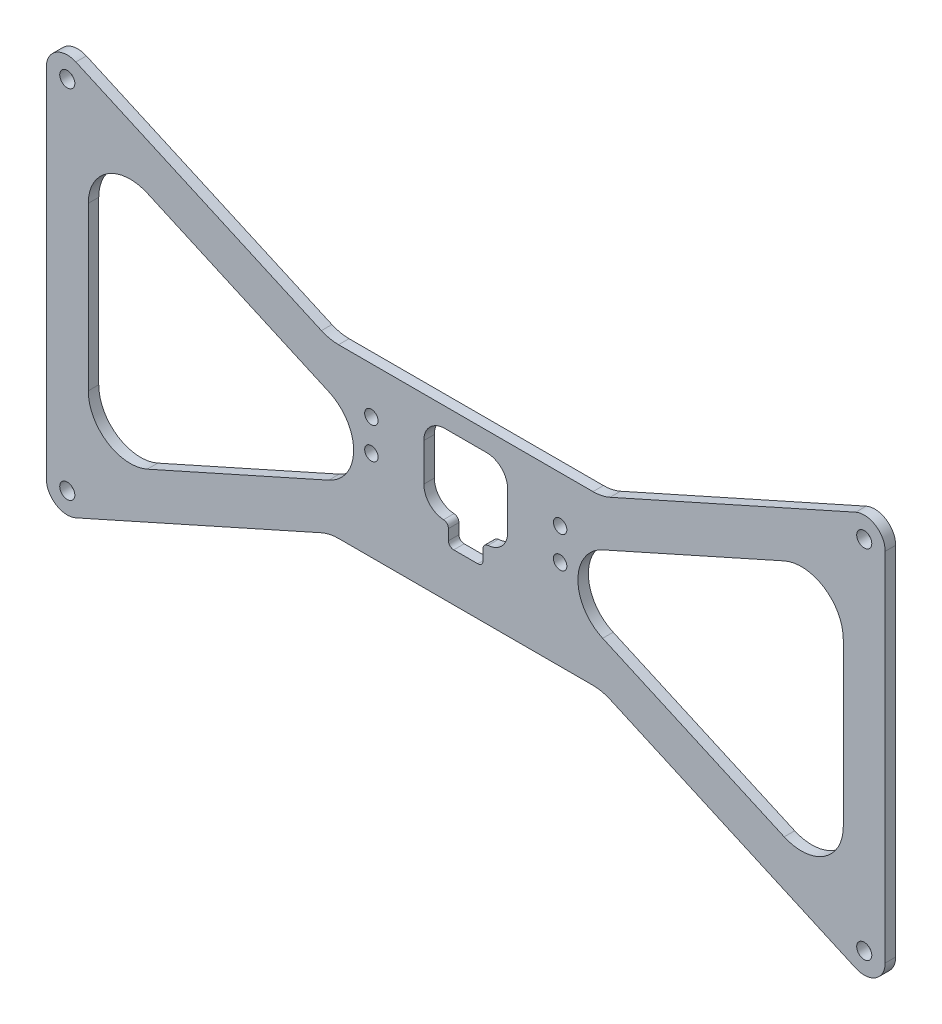
from build123d import *

# Parameters (mm, degrees)
BOSS_EXTRUDE1_DEPTH     = 3.175
SKETCH2_R               = 2.286
CUT_EXTRUDE1_DEPTH      = 141.634939649
FILLET1_R               = 12.7
SKETCH9_R               = 2.032
CUT_EXTRUDE6_DEPTH      = 141.634939649
CUT_EXTRUDE7_DEPTH      = 141.634939649
CUT_EXTRUDE7_DEPTH_BACK = 141.634939649
FILLET2_R               = 6.35
FILLET3_R               = 1.5875


with BuildPart() as part:
    # Sketch1 → Boss-Extrude1 (new body)
    with BuildSketch(Plane.XY):
        with BuildLine():
            Line((-118.056875519, -59.7713959), (-41.226696449, -25.4))
            Line((-41.226696449, -25.4), (41.226696449, -25.4))
            Line((41.226696449, -25.4), (118.056875519, -59.7713959))
            ThreePointArc((118.056875519, -59.7713959), (124.103705224, -59.303641499), (127, -53.975))
            Line((127, -53.975), (127, 53.975))
            ThreePointArc((127, 53.975), (124.103705224, 59.303641499), (118.056875519, 59.7713959))
            Line((118.056875519, 59.7713959), (41.226696449, 25.4))
            Line((41.226696449, 25.4), (-41.226696449, 25.4))
            Line((-41.226696449, 25.4), (-118.056875519, 59.7713959))
            ThreePointArc((-118.056875519, 59.7713959), (-124.103705224, 59.303641499), (-127, 53.975))
            Line((-127, 53.975), (-127, -53.975))
            ThreePointArc((-127, -53.975), (-124.103705224, -59.303641499), (-118.056875519, -59.7713959))
        make_face()
        Polygon((-114.3, -44.177732622), (-15.549774139, 0), (-114.3, 44.177732622), align=None, mode=Mode.SUBTRACT)
        Polygon((15.549774139, 0), (114.3, 44.177732622), (114.3, -44.177732622), align=None, mode=Mode.SUBTRACT)
    extrude(amount=BOSS_EXTRUDE1_DEPTH)

    # Sketch2 → Cut-Extrude1 (cut, through all)
    with BuildSketch(Plane.XY.offset(3.175)):
        with Locations((-120.65, 53.975)):
            Circle(SKETCH2_R)
        with Locations((-120.65, -53.975)):
            Circle(SKETCH2_R)
        with Locations((120.65, -53.975)):
            Circle(SKETCH2_R)
        with Locations((120.65, 53.975)):
            Circle(SKETCH2_R)
    extrude(amount=-CUT_EXTRUDE1_DEPTH, mode=Mode.SUBTRACT)

    # Fillet1
    fillet1_edges = [part.edges().sort_by_distance(p)[0] for p in [
        (114.3, -44.177732622, 1.5875),
        (114.3, 44.177732622, 1.5875),
        (15.549774139, 0, 1.5875),
        (-114.3, -44.177732622, 1.5875),
        (-15.549774139, 0, 1.5875),
        (-114.3, 44.177732622, 1.5875),
        (-41.226696449, 25.4, 1.5875),
        (41.226696449, 25.4, 1.5875),
        (41.226696449, -25.4, 1.5875),
        (-41.226696449, -25.4, 1.5875),
    ]]
    fillet(fillet1_edges, radius=FILLET1_R)

    # Sketch9 → Cut-Extrude6 (cut, symmetric)
    with BuildSketch(Plane.XY.offset(3.175)):
        with Locations((28.575, 11.413372752)):
            Circle(SKETCH9_R)
        with Locations((28.575, 1.888372752)):
            Circle(SKETCH9_R)
    cut_extrude6 = extrude(amount=CUT_EXTRUDE6_DEPTH, both=True, mode=Mode.SUBTRACT)

    # Sketch10 → Cut-Extrude7 (cut, two sides: drawn at the far end of the back side and taken through both)
    with BuildSketch(Plane.XY.offset(3.175).offset(-CUT_EXTRUDE7_DEPTH_BACK)):
        Polygon((-12.7, 19.52625), (12.7, 19.52625), (12.7, -4.60375), (5.23875, -4.60375), (5.23875, -10.95375), (-5.23875, -10.95375), (-5.23875, -4.60375), (-12.7, -4.60375), align=None)
    extrude(amount=CUT_EXTRUDE7_DEPTH + CUT_EXTRUDE7_DEPTH_BACK, mode=Mode.SUBTRACT)

    # Fillet2
    fillet2_edges = [part.edges().sort_by_distance(p)[0] for p in [
        (-12.7, -4.60375, 1.5875),
        (12.7, -4.60375, 1.5875),
        (12.7, 19.52625, 1.5875),
        (-12.7, 19.52625, 1.5875),
    ]]
    fillet(fillet2_edges, radius=FILLET2_R)

    # Fillet3
    fillet3_edges = [part.edges().sort_by_distance(p)[0] for p in [
        (-5.23875, -10.95375, 1.5875),
        (5.23875, -10.95375, 1.5875),
        (5.23875, -4.60375, 1.5875),
        (-5.23875, -4.60375, 1.5875),
    ]]
    fillet(fillet3_edges, radius=FILLET3_R)

    # Mirror1: Cut-Extrude6 across plane
    add(cut_extrude6.mirror(Plane(origin=(0, 0, 0), x_dir=(0, 0, 1), z_dir=(1, 0, 0))), mode=Mode.SUBTRACT)


solid = part.part
